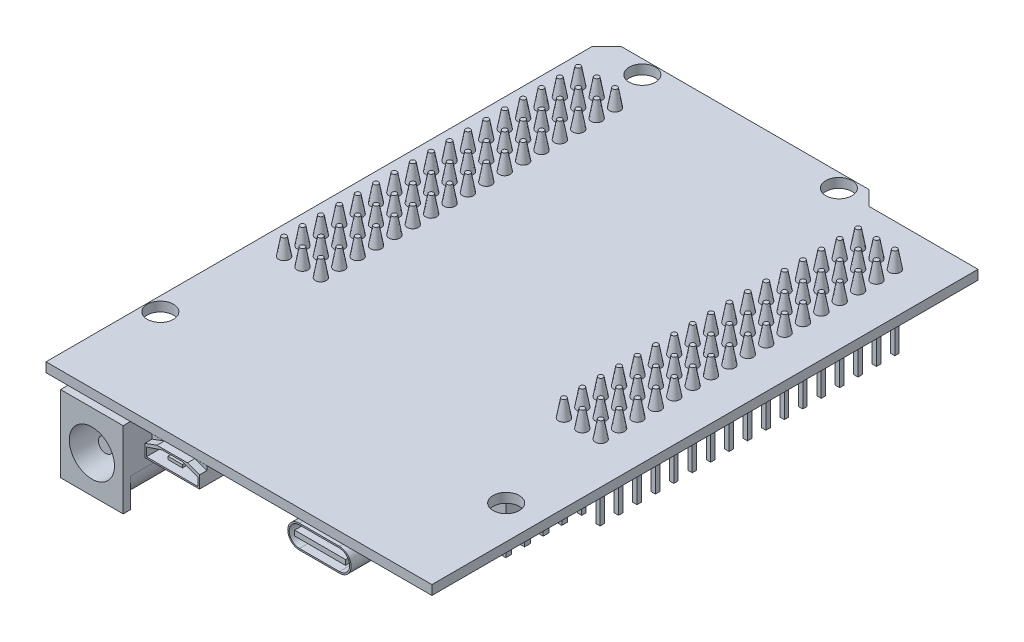
from build123d import *

# Parameters (mm, degrees)
SKETCH1_R                     = 1.8
BOSS_EXTRUDE1_DEPTH           = 1.3
SKETCH2_R                     = 0.75
BOSS_EXTRUDE2_DEPTH           = 2.4
BOSS_EXTRUDE2_TAPER           = 10
BOSS_EXTRUDE2_OTHER_WAY_DEPTH = 10
BOSS_EXTRUDE2_OTHER_WAY_TAPER = 3
SKETCH3_W                     = 2.525
SKETCH3_H                     = 42.925
BOSS_EXTRUDE3_DEPTH           = 2.525
SKETCH3_3_W                   = 2.525
SKETCH3_3_H                   = 42.925
BOSS_EXTRUDE4_DEPTH           = 2.525
SKETCH3_4_W                   = 2.525
SKETCH3_4_H                   = 42.925
BOSS_EXTRUDE5_DEPTH           = 2.525
SKETCH4_W                     = 8.6
SKETCH4_H                     = 10.5
SKETCH4_R                     = 3.1
BOSS_EXTRUDE6_DEPTH           = 10
FILLET1_R                     = 4
BOSS_EXTRUDE7_START           = 1
SKETCH4_2_W                   = 8.6
SKETCH4_2_H                   = 10.5
SKETCH4_2_R                   = 3.1
BOSS_EXTRUDE7_DEPTH           = 1
BOSS_EXTRUDE8_DEPTH           = 1
SKETCH7_W                     = 2.525
SKETCH7_H                     = 48.6
BOSS_EXTRUDE9_DEPTH           = 10.8
SKETCH8_W                     = 27.4
SKETCH8_H                     = 54.8
BOSS_EXTRUDE10_DEPTH          = 1.3
SKETCH9_W                     = 54.8
SKETCH9_H                     = 1.3
BOSS_EXTRUDE11_DEPTH          = 0.1
SKETCH10_W                    = 27.5
SKETCH10_H                    = 1.3
BOSS_EXTRUDE12_DEPTH          = 0.1
SKETCH11_W                    = 54.9
SKETCH11_H                    = 1.3
BOSS_EXTRUDE13_DEPTH          = 0.1
SKETCH12_W                    = 27.6
SKETCH12_H                    = 1.3
BOSS_EXTRUDE14_DEPTH          = 0.1
SKETCH13_R                    = 1
BOSS_EXTRUDE15_DEPTH          = 8.1
SKETCH14_R                    = 1.4
CUT_EXTRUDE1_DEPTH            = 1.3
SKETCH15_R                    = 0.9
BOSS_EXTRUDE16_DEPTH          = 1
BOSS_EXTRUDE16_TAPER          = 25
SKETCH16_W                    = 15.8
SKETCH16_H                    = 17.5
BOSS_EXTRUDE17_DEPTH          = 3
SKETCH17_W                    = 15.8
SKETCH17_H                    = 7.7
BOSS_EXTRUDE18_DEPTH          = 1
SKETCH18_W                    = 7.5
SKETCH18_H                    = 5.2
BOSS_EXTRUDE19_DEPTH          = 2.3
SKETCH19_W                    = 3.454198242
SKETCH19_H                    = 0.789142839
CUT_EXTRUDE2_DEPTH            = 1
CUT_EXTRUDE3_DEPTH            = 3.9
SKETCH21_W                    = 2
SKETCH21_H                    = 0.4
BOSS_EXTRUDE20_DEPTH          = 3.5
CUT_EXTRUDE4_DEPTH            = 1.3
SKETCH23_W                    = 2.7
SKETCH23_H                    = 3.7
BOSS_EXTRUDE21_DEPTH          = 1.1
SKETCH24_R                    = 0.75
BOSS_EXTRUDE22_DEPTH          = 0.5
BOSS_EXTRUDE23_DEPTH          = 0.5
BOSS_EXTRUDE23_DEPTH_BACK     = 6.6
BOSS_EXTRUDE24_DEPTH          = 0.5
SKETCH27_W                    = 7
SKETCH27_H                    = 0.7
BOSS_EXTRUDE25_DEPTH          = 6.5
LPATTERN1_COUNT               = 2
LPATTERN1_PITCH               = 27
SKETCH29_W                    = 5.12
SKETCH29_H                    = 10.24
BOSS_EXTRUDE26_DEPTH          = 2.6
SKETCH30_W                    = 0.6
SKETCH30_H                    = 0.6
BOSS_EXTRUDE27_DEPTH          = 5.5
SKETCH31_W                    = 0.6
SKETCH31_H                    = 0.6
BOSS_EXTRUDE28_DEPTH          = 7.5
SKETCH34_W                    = 13.1738133
SKETCH34_H                    = 54.591483904
SKETCH34_W_2                  = 0.6
SKETCH34_H_2                  = 0.6
SKETCH34_W_3                  = 10.47916967
SKETCH34_H_3                  = 53.892872592
CUT_EXTRUDE5_DEPTH            = 6.175
SKETCH36_W                    = 5.12
SKETCH36_H                    = 10.24
BOSS_EXTRUDE29_DEPTH          = 2.6
SKETCH37_W                    = 0.8
SKETCH37_H                    = 0.8
BOSS_EXTRUDE30_DEPTH          = 5.5


with BuildPart() as part:
    # Sketch1 → Boss-Extrude1 (new body)
    with BuildSketch(Plane(origin=(0, 0, 0), x_dir=(1, 0, 0), z_dir=(0, 1, 0))):
        Polygon((0, 0), (0, 75), (2, 77), (36, 77), (38, 75), (53, 75), (53, 0), align=None)
        with Locations(Location((6.8, 75.1, 0), (0, 0, 270))):
            Circle(SKETCH1_R, mode=Mode.SUBTRACT)
        with Locations(Location((33.8, 75.1, 0), (0, 0, 270))):
            Circle(SKETCH1_R, mode=Mode.SUBTRACT)
        with Locations(Location((1.9, 13.8, 0), (0, 0, 270))):
            Circle(SKETCH1_R, mode=Mode.SUBTRACT)
        with Locations(Location((48.4, 14.8, 0), (0, 0, 270))):
            Circle(SKETCH1_R, mode=Mode.SUBTRACT)
    extrude(amount=BOSS_EXTRUDE1_DEPTH)

    # Sketch2 → Boss-Extrude2 (add)
    with BuildSketch(Plane(origin=(0, 1.3, 0), x_dir=(1, 0, 0), z_dir=(0, 1, 0))):
        with Locations((3.8, 69.3)):
            Circle(SKETCH2_R)
        with Locations((6.325, 69.3)):
            Circle(SKETCH2_R)
        with Locations((8.85, 69.3)):
            Circle(SKETCH2_R)
        with Locations((6.325, 66.775)):
            Circle(SKETCH2_R)
        with Locations((8.85, 66.775)):
            Circle(SKETCH2_R)
        with Locations((6.325, 64.25)):
            Circle(SKETCH2_R)
        with Locations((8.85, 64.25)):
            Circle(SKETCH2_R)
        with Locations((6.325, 61.725)):
            Circle(SKETCH2_R)
        with Locations((8.85, 61.725)):
            Circle(SKETCH2_R)
        with Locations((6.325, 59.2)):
            Circle(SKETCH2_R)
        with Locations((8.85, 59.2)):
            Circle(SKETCH2_R)
        with Locations((6.325, 56.675)):
            Circle(SKETCH2_R)
        with Locations((8.85, 56.675)):
            Circle(SKETCH2_R)
        with Locations((6.325, 54.15)):
            Circle(SKETCH2_R)
        with Locations((8.85, 54.15)):
            Circle(SKETCH2_R)
        with Locations((6.325, 51.625)):
            Circle(SKETCH2_R)
        with Locations((8.85, 51.625)):
            Circle(SKETCH2_R)
        with Locations((6.325, 49.1)):
            Circle(SKETCH2_R)
        with Locations((8.85, 49.1)):
            Circle(SKETCH2_R)
        with Locations((6.325, 46.575)):
            Circle(SKETCH2_R)
        with Locations((8.85, 46.575)):
            Circle(SKETCH2_R)
        with Locations((6.325, 44.05)):
            Circle(SKETCH2_R)
        with Locations((8.85, 44.05)):
            Circle(SKETCH2_R)
        with Locations((6.325, 41.525)):
            Circle(SKETCH2_R)
        with Locations((8.85, 41.525)):
            Circle(SKETCH2_R)
        with Locations((6.325, 39)):
            Circle(SKETCH2_R)
        with Locations((8.85, 39)):
            Circle(SKETCH2_R)
        with Locations((6.325, 36.475)):
            Circle(SKETCH2_R)
        with Locations((8.85, 36.475)):
            Circle(SKETCH2_R)
        with Locations((6.325, 33.95)):
            Circle(SKETCH2_R)
        with Locations((8.85, 33.95)):
            Circle(SKETCH2_R)
        with Locations((6.325, 31.425)):
            Circle(SKETCH2_R)
        with Locations((8.85, 31.425)):
            Circle(SKETCH2_R)
        with Locations((3.8, 66.775)):
            Circle(SKETCH2_R)
        with Locations((3.8, 64.25)):
            Circle(SKETCH2_R)
        with Locations((3.8, 61.725)):
            Circle(SKETCH2_R)
        with Locations((3.8, 59.2)):
            Circle(SKETCH2_R)
        with Locations((3.8, 56.675)):
            Circle(SKETCH2_R)
        with Locations((3.8, 54.15)):
            Circle(SKETCH2_R)
        with Locations((3.8, 51.625)):
            Circle(SKETCH2_R)
        with Locations((3.8, 49.1)):
            Circle(SKETCH2_R)
        with Locations((3.8, 46.575)):
            Circle(SKETCH2_R)
        with Locations((3.8, 44.05)):
            Circle(SKETCH2_R)
        with Locations((3.8, 41.525)):
            Circle(SKETCH2_R)
        with Locations((3.8, 39)):
            Circle(SKETCH2_R)
        with Locations((3.8, 36.475)):
            Circle(SKETCH2_R)
        with Locations((3.8, 33.95)):
            Circle(SKETCH2_R)
        with Locations((3.8, 31.425)):
            Circle(SKETCH2_R)
        with Locations((3.8, 28.9)):
            Circle(SKETCH2_R)
        with Locations((6.325, 28.9)):
            Circle(SKETCH2_R)
        with Locations((8.85, 28.9)):
            Circle(SKETCH2_R)
        with Locations((42.234359974, 28.9)):
            Circle(SKETCH2_R)
        with Locations((44.759359974, 28.9)):
            Circle(SKETCH2_R)
        with Locations((47.284359974, 28.9)):
            Circle(SKETCH2_R)
        with Locations((47.284359974, 31.425)):
            Circle(SKETCH2_R)
        with Locations((47.284359974, 33.95)):
            Circle(SKETCH2_R)
        with Locations((47.284359974, 36.475)):
            Circle(SKETCH2_R)
        with Locations((47.284359974, 39)):
            Circle(SKETCH2_R)
        with Locations((47.284359974, 41.525)):
            Circle(SKETCH2_R)
        with Locations((47.284359974, 44.05)):
            Circle(SKETCH2_R)
        with Locations((47.284359974, 46.575)):
            Circle(SKETCH2_R)
        with Locations((47.284359974, 49.1)):
            Circle(SKETCH2_R)
        with Locations((47.284359974, 51.625)):
            Circle(SKETCH2_R)
        with Locations((47.284359974, 54.15)):
            Circle(SKETCH2_R)
        with Locations((47.284359974, 56.675)):
            Circle(SKETCH2_R)
        with Locations((47.284359974, 59.2)):
            Circle(SKETCH2_R)
        with Locations((47.284359974, 61.725)):
            Circle(SKETCH2_R)
        with Locations((47.284359974, 64.25)):
            Circle(SKETCH2_R)
        with Locations((47.284359974, 66.775)):
            Circle(SKETCH2_R)
        with Locations((42.234359974, 31.425)):
            Circle(SKETCH2_R)
        with Locations((44.759359974, 31.425)):
            Circle(SKETCH2_R)
        with Locations((42.234359974, 33.95)):
            Circle(SKETCH2_R)
        with Locations((44.759359974, 33.95)):
            Circle(SKETCH2_R)
        with Locations((42.234359974, 36.475)):
            Circle(SKETCH2_R)
        with Locations((44.759359974, 36.475)):
            Circle(SKETCH2_R)
        with Locations((42.234359974, 39)):
            Circle(SKETCH2_R)
        with Locations((44.759359974, 39)):
            Circle(SKETCH2_R)
        with Locations((42.234359974, 41.525)):
            Circle(SKETCH2_R)
        with Locations((44.759359974, 41.525)):
            Circle(SKETCH2_R)
        with Locations((42.234359974, 44.05)):
            Circle(SKETCH2_R)
        with Locations((44.759359974, 44.05)):
            Circle(SKETCH2_R)
        with Locations((42.234359974, 46.575)):
            Circle(SKETCH2_R)
        with Locations((44.759359974, 46.575)):
            Circle(SKETCH2_R)
        with Locations((42.234359974, 49.1)):
            Circle(SKETCH2_R)
        with Locations((44.759359974, 49.1)):
            Circle(SKETCH2_R)
        with Locations((42.234359974, 51.625)):
            Circle(SKETCH2_R)
        with Locations((44.759359974, 51.625)):
            Circle(SKETCH2_R)
        with Locations((42.234359974, 54.15)):
            Circle(SKETCH2_R)
        with Locations((44.759359974, 54.15)):
            Circle(SKETCH2_R)
        with Locations((42.234359974, 56.675)):
            Circle(SKETCH2_R)
        with Locations((44.759359974, 56.675)):
            Circle(SKETCH2_R)
        with Locations((42.234359974, 59.2)):
            Circle(SKETCH2_R)
        with Locations((44.759359974, 59.2)):
            Circle(SKETCH2_R)
        with Locations((42.234359974, 61.725)):
            Circle(SKETCH2_R)
        with Locations((44.759359974, 61.725)):
            Circle(SKETCH2_R)
        with Locations((42.234359974, 64.25)):
            Circle(SKETCH2_R)
        with Locations((44.759359974, 64.25)):
            Circle(SKETCH2_R)
        with Locations((42.234359974, 66.775)):
            Circle(SKETCH2_R)
        with Locations((44.759359974, 66.775)):
            Circle(SKETCH2_R)
        with Locations((42.234359974, 69.3)):
            Circle(SKETCH2_R)
        with Locations((44.759359974, 69.3)):
            Circle(SKETCH2_R)
        with Locations((47.284359974, 69.3)):
            Circle(SKETCH2_R)
    extrude(amount=BOSS_EXTRUDE2_DEPTH, taper=BOSS_EXTRUDE2_TAPER)

    # Sketch2 → Boss-Extrude2 other way (add)
    with BuildSketch(Plane(origin=(0, 1.3, 0), x_dir=(1, 0, 0), z_dir=(0, 1, 0))):
        with Locations((3.8, 69.3)):
            Circle(SKETCH2_R)
        with Locations((6.325, 69.3)):
            Circle(SKETCH2_R)
        with Locations((8.85, 69.3)):
            Circle(SKETCH2_R)
        with Locations((6.325, 66.775)):
            Circle(SKETCH2_R)
        with Locations((8.85, 66.775)):
            Circle(SKETCH2_R)
        with Locations((6.325, 64.25)):
            Circle(SKETCH2_R)
        with Locations((8.85, 64.25)):
            Circle(SKETCH2_R)
        with Locations((6.325, 61.725)):
            Circle(SKETCH2_R)
        with Locations((8.85, 61.725)):
            Circle(SKETCH2_R)
        with Locations((6.325, 59.2)):
            Circle(SKETCH2_R)
        with Locations((8.85, 59.2)):
            Circle(SKETCH2_R)
        with Locations((6.325, 56.675)):
            Circle(SKETCH2_R)
        with Locations((8.85, 56.675)):
            Circle(SKETCH2_R)
        with Locations((6.325, 54.15)):
            Circle(SKETCH2_R)
        with Locations((8.85, 54.15)):
            Circle(SKETCH2_R)
        with Locations((6.325, 51.625)):
            Circle(SKETCH2_R)
        with Locations((8.85, 51.625)):
            Circle(SKETCH2_R)
        with Locations((6.325, 49.1)):
            Circle(SKETCH2_R)
        with Locations((8.85, 49.1)):
            Circle(SKETCH2_R)
        with Locations((6.325, 46.575)):
            Circle(SKETCH2_R)
        with Locations((8.85, 46.575)):
            Circle(SKETCH2_R)
        with Locations((6.325, 44.05)):
            Circle(SKETCH2_R)
        with Locations((8.85, 44.05)):
            Circle(SKETCH2_R)
        with Locations((6.325, 41.525)):
            Circle(SKETCH2_R)
        with Locations((8.85, 41.525)):
            Circle(SKETCH2_R)
        with Locations((6.325, 39)):
            Circle(SKETCH2_R)
        with Locations((8.85, 39)):
            Circle(SKETCH2_R)
        with Locations((6.325, 36.475)):
            Circle(SKETCH2_R)
        with Locations((8.85, 36.475)):
            Circle(SKETCH2_R)
        with Locations((6.325, 33.95)):
            Circle(SKETCH2_R)
        with Locations((8.85, 33.95)):
            Circle(SKETCH2_R)
        with Locations((6.325, 31.425)):
            Circle(SKETCH2_R)
        with Locations((8.85, 31.425)):
            Circle(SKETCH2_R)
        with Locations((3.8, 66.775)):
            Circle(SKETCH2_R)
        with Locations((3.8, 64.25)):
            Circle(SKETCH2_R)
        with Locations((3.8, 61.725)):
            Circle(SKETCH2_R)
        with Locations((3.8, 59.2)):
            Circle(SKETCH2_R)
        with Locations((3.8, 56.675)):
            Circle(SKETCH2_R)
        with Locations((3.8, 54.15)):
            Circle(SKETCH2_R)
        with Locations((3.8, 51.625)):
            Circle(SKETCH2_R)
        with Locations((3.8, 49.1)):
            Circle(SKETCH2_R)
        with Locations((3.8, 46.575)):
            Circle(SKETCH2_R)
        with Locations((3.8, 44.05)):
            Circle(SKETCH2_R)
        with Locations((3.8, 41.525)):
            Circle(SKETCH2_R)
        with Locations((3.8, 39)):
            Circle(SKETCH2_R)
        with Locations((3.8, 36.475)):
            Circle(SKETCH2_R)
        with Locations((3.8, 33.95)):
            Circle(SKETCH2_R)
        with Locations((3.8, 31.425)):
            Circle(SKETCH2_R)
        with Locations((3.8, 28.9)):
            Circle(SKETCH2_R)
        with Locations((6.325, 28.9)):
            Circle(SKETCH2_R)
        with Locations((8.85, 28.9)):
            Circle(SKETCH2_R)
        with Locations((42.234359974, 28.9)):
            Circle(SKETCH2_R)
        with Locations((44.759359974, 28.9)):
            Circle(SKETCH2_R)
        with Locations((47.284359974, 28.9)):
            Circle(SKETCH2_R)
        with Locations((47.284359974, 31.425)):
            Circle(SKETCH2_R)
        with Locations((47.284359974, 33.95)):
            Circle(SKETCH2_R)
        with Locations((47.284359974, 36.475)):
            Circle(SKETCH2_R)
        with Locations((47.284359974, 39)):
            Circle(SKETCH2_R)
        with Locations((47.284359974, 41.525)):
            Circle(SKETCH2_R)
        with Locations((47.284359974, 44.05)):
            Circle(SKETCH2_R)
        with Locations((47.284359974, 46.575)):
            Circle(SKETCH2_R)
        with Locations((47.284359974, 49.1)):
            Circle(SKETCH2_R)
        with Locations((47.284359974, 51.625)):
            Circle(SKETCH2_R)
        with Locations((47.284359974, 54.15)):
            Circle(SKETCH2_R)
        with Locations((47.284359974, 56.675)):
            Circle(SKETCH2_R)
        with Locations((47.284359974, 59.2)):
            Circle(SKETCH2_R)
        with Locations((47.284359974, 61.725)):
            Circle(SKETCH2_R)
        with Locations((47.284359974, 64.25)):
            Circle(SKETCH2_R)
        with Locations((47.284359974, 66.775)):
            Circle(SKETCH2_R)
        with Locations((42.234359974, 31.425)):
            Circle(SKETCH2_R)
        with Locations((44.759359974, 31.425)):
            Circle(SKETCH2_R)
        with Locations((42.234359974, 33.95)):
            Circle(SKETCH2_R)
        with Locations((44.759359974, 33.95)):
            Circle(SKETCH2_R)
        with Locations((42.234359974, 36.475)):
            Circle(SKETCH2_R)
        with Locations((44.759359974, 36.475)):
            Circle(SKETCH2_R)
        with Locations((42.234359974, 39)):
            Circle(SKETCH2_R)
        with Locations((44.759359974, 39)):
            Circle(SKETCH2_R)
        with Locations((42.234359974, 41.525)):
            Circle(SKETCH2_R)
        with Locations((44.759359974, 41.525)):
            Circle(SKETCH2_R)
        with Locations((42.234359974, 44.05)):
            Circle(SKETCH2_R)
        with Locations((44.759359974, 44.05)):
            Circle(SKETCH2_R)
        with Locations((42.234359974, 46.575)):
            Circle(SKETCH2_R)
        with Locations((44.759359974, 46.575)):
            Circle(SKETCH2_R)
        with Locations((42.234359974, 49.1)):
            Circle(SKETCH2_R)
        with Locations((44.759359974, 49.1)):
            Circle(SKETCH2_R)
        with Locations((42.234359974, 51.625)):
            Circle(SKETCH2_R)
        with Locations((44.759359974, 51.625)):
            Circle(SKETCH2_R)
        with Locations((42.234359974, 54.15)):
            Circle(SKETCH2_R)
        with Locations((44.759359974, 54.15)):
            Circle(SKETCH2_R)
        with Locations((42.234359974, 56.675)):
            Circle(SKETCH2_R)
        with Locations((44.759359974, 56.675)):
            Circle(SKETCH2_R)
        with Locations((42.234359974, 59.2)):
            Circle(SKETCH2_R)
        with Locations((44.759359974, 59.2)):
            Circle(SKETCH2_R)
        with Locations((42.234359974, 61.725)):
            Circle(SKETCH2_R)
        with Locations((44.759359974, 61.725)):
            Circle(SKETCH2_R)
        with Locations((42.234359974, 64.25)):
            Circle(SKETCH2_R)
        with Locations((44.759359974, 64.25)):
            Circle(SKETCH2_R)
        with Locations((42.234359974, 66.775)):
            Circle(SKETCH2_R)
        with Locations((44.759359974, 66.775)):
            Circle(SKETCH2_R)
        with Locations((42.234359974, 69.3)):
            Circle(SKETCH2_R)
        with Locations((44.759359974, 69.3)):
            Circle(SKETCH2_R)
        with Locations((47.284359974, 69.3)):
            Circle(SKETCH2_R)
    extrude(amount=-BOSS_EXTRUDE2_OTHER_WAY_DEPTH, taper=BOSS_EXTRUDE2_OTHER_WAY_TAPER)

    # Sketch3 → Boss-Extrude3 (add)
    with BuildSketch(Plane.XZ):
        with Locations((3.8, -49.1)):
            Rectangle(SKETCH3_W, SKETCH3_H)
        with Locations((47.284359974, -49.1)):
            Rectangle(SKETCH3_W, SKETCH3_H)
    extrude(amount=BOSS_EXTRUDE3_DEPTH)

    # Sketch3<3> → Boss-Extrude4 (add)
    with BuildSketch(Plane.XZ):
        with Locations((6.34, -49.1)):
            Rectangle(SKETCH3_3_W, SKETCH3_3_H)
        with Locations((44.744359974, -49.1)):
            Rectangle(SKETCH3_3_W, SKETCH3_3_H)
    extrude(amount=BOSS_EXTRUDE4_DEPTH)

    # Sketch3<4> → Boss-Extrude5 (add)
    with BuildSketch(Plane.XZ):
        with Locations((8.88, -49.1)):
            Rectangle(SKETCH3_4_W, SKETCH3_4_H)
        with Locations((42.204359974, -49.1)):
            Rectangle(SKETCH3_4_W, SKETCH3_4_H)
    extrude(amount=BOSS_EXTRUDE5_DEPTH)

    # Sketch4 → Boss-Extrude6 (add)
    with BuildSketch(Plane.XY):
        with Locations((7.3, -5.25)):
            Rectangle(SKETCH4_W, SKETCH4_H)
        with Locations((7.3, -5.4)):
            Circle(SKETCH4_R, mode=Mode.SUBTRACT)
    extrude(amount=-BOSS_EXTRUDE6_DEPTH)

    # Fillet1
    fillet1_edges = [part.edges().sort_by_distance(p)[0] for p in [
        (11.6, -10.5, -5),
        (3, -10.5, -5),
    ]]
    fillet(fillet1_edges, radius=FILLET1_R)

    # Sketch4<2> → Boss-Extrude7 (add)
    with BuildSketch(Plane.XY.offset(BOSS_EXTRUDE7_START)):
        with Locations((7.3, -5.25)):
            Rectangle(SKETCH4_2_W, SKETCH4_2_H)
        with Locations((7.3, -5.4)):
            Circle(SKETCH4_2_R, mode=Mode.SUBTRACT)
    extrude(amount=-BOSS_EXTRUDE7_DEPTH)

    # Sketch5 → Boss-Extrude8 (add)
    with BuildSketch(Plane(origin=(0, 0, -10), x_dir=(-1, 0, 0), z_dir=(0, 0, -1))):
        with BuildLine():
            Line((-11.6, 0), (-11.6, -6.5))
            ThreePointArc((-11.6, -6.5), (-10.428427125, -9.328427125), (-7.6, -10.5))
            Line((-7.6, -10.5), (-7, -10.5))
            ThreePointArc((-7, -10.5), (-4.171572875, -9.328427125), (-3, -6.5))
            Line((-3, -6.5), (-3, 0))
            Line((-3, 0), (-11.6, 0))
        make_face()
    extrude(amount=-BOSS_EXTRUDE8_DEPTH)

    # Sketch7 → Boss-Extrude9 (add)
    with BuildSketch(Plane.XZ):
        with Locations((12.8625, -49.5)):
            Rectangle(SKETCH7_W, SKETCH7_H)
        with Locations((15.4225, -49.5)):
            Rectangle(SKETCH7_W, SKETCH7_H)
        with Locations((37.7375, -49.5)):
            Rectangle(SKETCH7_W, SKETCH7_H)
    extrude(amount=BOSS_EXTRUDE9_DEPTH)

    # Sketch8 → Boss-Extrude10 (add)
    with BuildSketch(Plane.XZ.offset(10.8)):
        with Locations((25.3, -49.6)):
            Rectangle(SKETCH8_W, SKETCH8_H)
    extrude(amount=BOSS_EXTRUDE10_DEPTH)

    # Sketch9 → Boss-Extrude11 (add)
    with BuildSketch(Plane(origin=(39, 0, 0), x_dir=(0, 0, -1), z_dir=(1, 0, 0))):
        with Locations((49.6, -11.45)):
            Rectangle(SKETCH9_W, SKETCH9_H)
    extrude(amount=BOSS_EXTRUDE11_DEPTH)

    # Sketch10 → Boss-Extrude12 (add)
    with BuildSketch(Plane.XY.offset(-22.2)):
        with Locations((25.35, -11.45)):
            Rectangle(SKETCH10_W, SKETCH10_H)
    extrude(amount=BOSS_EXTRUDE12_DEPTH)

    # Sketch11 → Boss-Extrude13 (add)
    with BuildSketch(Plane.ZY.offset(-11.6)):
        with Locations((-49.55, -11.45)):
            Rectangle(SKETCH11_W, SKETCH11_H)
    extrude(amount=BOSS_EXTRUDE13_DEPTH)

    # Sketch12 → Boss-Extrude14 (add)
    with BuildSketch(Plane(origin=(0, 0, -77), x_dir=(-1, 0, 0), z_dir=(0, 0, -1))):
        with Locations((-25.3, -11.45)):
            Rectangle(SKETCH12_W, SKETCH12_H)
    extrude(amount=BOSS_EXTRUDE14_DEPTH)

    # Sketch13 → Boss-Extrude15 (add)
    with BuildSketch(Plane.XY.offset(-9)):
        with Locations(Location((7.3, -5.4, 0), (0, 0, 180))):
            Circle(SKETCH13_R)
    extrude(amount=BOSS_EXTRUDE15_DEPTH)

    # Sketch14 → Cut-Extrude1 (cut)
    with BuildSketch(Plane.XZ.offset(12.1)):
        with Locations(Location((13.3, -23.9, 0), (0, 0, 270))):
            Circle(SKETCH14_R)
        with Locations(Location((13.3, -75.3, 0), (0, 0, 270))):
            Circle(SKETCH14_R)
        with Locations(Location((37.3, -23.9, 0), (0, 0, 248.213210702))):
            Circle(SKETCH14_R)
        with Locations(Location((37.3, -75.3, 0), (0, 0, 270))):
            Circle(SKETCH14_R)
    extrude(amount=-CUT_EXTRUDE1_DEPTH, mode=Mode.SUBTRACT)

    # Sketch15 → Boss-Extrude16 (add)
    with BuildSketch(Plane.XZ.offset(12.1)):
        with Locations((14.025, -71.275)):
            Circle(SKETCH15_R)
        with Locations((14.025, -68.745)):
            Circle(SKETCH15_R)
        with Locations((14.025, -66.215)):
            Circle(SKETCH15_R)
        with Locations((14.025, -63.685)):
            Circle(SKETCH15_R)
        with Locations((14.025, -61.155)):
            Circle(SKETCH15_R)
        with Locations((14.025, -58.625)):
            Circle(SKETCH15_R)
        with Locations((14.025, -56.095)):
            Circle(SKETCH15_R)
        with Locations((14.025, -53.565)):
            Circle(SKETCH15_R)
        with Locations((14.025, -51.035)):
            Circle(SKETCH15_R)
        with Locations((14.025, -48.505)):
            Circle(SKETCH15_R)
        with Locations((14.025, -45.975)):
            Circle(SKETCH15_R)
        with Locations((14.025, -43.445)):
            Circle(SKETCH15_R)
        with Locations((14.025, -40.915)):
            Circle(SKETCH15_R)
        with Locations((14.025, -38.385)):
            Circle(SKETCH15_R)
        with Locations((14.025, -35.855)):
            Circle(SKETCH15_R)
        with Locations((14.025, -33.325)):
            Circle(SKETCH15_R)
        with Locations((14.025, -30.795)):
            Circle(SKETCH15_R)
        with Locations((14.025, -28.265)):
            Circle(SKETCH15_R)
        with Locations((36.575, -28.265)):
            Circle(SKETCH15_R)
        with Locations((36.575, -30.795)):
            Circle(SKETCH15_R)
        with Locations((36.575, -33.325)):
            Circle(SKETCH15_R)
        with Locations((36.575, -35.855)):
            Circle(SKETCH15_R)
        with Locations((36.575, -38.385)):
            Circle(SKETCH15_R)
        with Locations((36.575, -40.915)):
            Circle(SKETCH15_R)
        with Locations((36.575, -43.445)):
            Circle(SKETCH15_R)
        with Locations((36.575, -45.975)):
            Circle(SKETCH15_R)
        with Locations((36.575, -48.505)):
            Circle(SKETCH15_R)
        with Locations((36.575, -51.035)):
            Circle(SKETCH15_R)
        with Locations((36.575, -53.565)):
            Circle(SKETCH15_R)
        with Locations((36.575, -56.095)):
            Circle(SKETCH15_R)
        with Locations((36.575, -58.625)):
            Circle(SKETCH15_R)
        with Locations((36.575, -61.155)):
            Circle(SKETCH15_R)
        with Locations((36.575, -63.685)):
            Circle(SKETCH15_R)
        with Locations((36.575, -66.215)):
            Circle(SKETCH15_R)
        with Locations((36.575, -68.745)):
            Circle(SKETCH15_R)
        with Locations((36.575, -71.275)):
            Circle(SKETCH15_R)
    extrude(amount=BOSS_EXTRUDE16_DEPTH, taper=BOSS_EXTRUDE16_TAPER)

    # Sketch16 → Boss-Extrude17 (add)
    with BuildSketch(Plane.XZ.offset(12.1)):
        with Locations((25.3, -60.65)):
            Rectangle(SKETCH16_W, SKETCH16_H)
    extrude(amount=BOSS_EXTRUDE17_DEPTH)

    # Sketch17 → Boss-Extrude18 (add)
    with BuildSketch(Plane.XZ.offset(12.1)):
        with Locations((25.3, -73.25)):
            Rectangle(SKETCH17_W, SKETCH17_H)
    extrude(amount=BOSS_EXTRUDE18_DEPTH)

    # Sketch18 → Boss-Extrude19 (add)
    with BuildSketch(Plane.XZ.offset(12.1)):
        with Locations((25.3, -24.7)):
            Rectangle(SKETCH18_W, SKETCH18_H)
    boss_extrude19 = extrude(amount=BOSS_EXTRUDE19_DEPTH)

    # Sketch19 → Cut-Extrude2 (cut)
    # profile 1 of 3: a face of its own
    with BuildSketch(Plane.XY.offset(-22.1)):
        Polygon((26.675700123, -12.3), (23.946955958, -12.3), (21.75, -13.03042035), (21.75, -14.2), (28.85, -14.2), (28.85, -13.0996639), align=None)
        with Locations((25.3, -13.223743794)):
            Rectangle(SKETCH19_W, SKETCH19_H, mode=Mode.SUBTRACT)
    # profile 2 of 3: a face of its own
    with BuildSketch(Plane.XY.offset(-22.1)):
        Polygon((27.390959614, -12.1), (29.05, -12.7), (29.05, -12.1), align=None)
    # profile 3 of 3: a face of its own
    with BuildSketch(Plane.XY.offset(-22.1)):
        Polygon((23.209040386, -12.1), (21.55, -12.1), (21.55, -12.7), align=None)
    cut_extrude2 = extrude(amount=-CUT_EXTRUDE2_DEPTH, mode=Mode.SUBTRACT)

    # Sketch20 → Cut-Extrude3 (cut)
    with BuildSketch(Plane.XY.offset(-22.1)):
        Polygon((26.675700123, -12.3), (23.946955958, -12.3), (21.75, -13.03042035), (21.75, -14.2), (28.85, -14.2), (28.85, -13.0996639), align=None)
    cut_extrude3 = extrude(amount=-CUT_EXTRUDE3_DEPTH, mode=Mode.SUBTRACT)

    # Sketch21 → Boss-Extrude20 (add)
    with BuildSketch(Plane.XY.offset(-26)):
        with Locations((25.30566402, -13.25)):
            Rectangle(SKETCH21_W, SKETCH21_H)
    boss_extrude20 = extrude(amount=BOSS_EXTRUDE20_DEPTH)

    # Sketch22 → Cut-Extrude4 (cut)
    with BuildSketch(Plane(origin=(0, -10.8, 0), x_dir=(1, 0, 0), z_dir=(0, 1, 0))):
        Polygon((20.472121, 22.1), (25.3, 22.1), (25.3, 23.177879), (21.55, 23.177879), align=None)
        Polygon((25.3, 23.177879), (25.3, 22.1), (30.127879, 22.1), (29.05, 23.177879), align=None)
    extrude(amount=-CUT_EXTRUDE4_DEPTH, mode=Mode.SUBTRACT)

    # Sketch23 → Boss-Extrude21 (add)
    with BuildSketch(Plane.XZ.offset(12.1)):
        with Locations((17.75, -24.75)):
            Rectangle(SKETCH23_W, SKETCH23_H)
        with Locations((32.85, -24.75)):
            Rectangle(SKETCH23_W, SKETCH23_H)
    extrude(amount=BOSS_EXTRUDE21_DEPTH)

    # Sketch24 → Boss-Extrude22 (add)
    with BuildSketch(Plane.XZ.offset(13.2)):
        with Locations(Location((17.75, -24.75, 0), (0, 0, 270))):
            Circle(SKETCH24_R)
        with Locations(Location((32.85, -24.75, 0), (0, 0, 90))):
            Circle(SKETCH24_R)
    extrude(amount=BOSS_EXTRUDE22_DEPTH)

    # Sketch25 → Boss-Extrude23 (add, two sides: drawn at the far end of the back side and taken through both)
    with BuildSketch(Plane.XY.offset(-BOSS_EXTRUDE23_DEPTH_BACK)):
        with BuildLine():
            Line((35.3, 0), (40.8, 0))
            ThreePointArc((40.8, 0), (42.4, -1.6), (40.8, -3.2))
            Line((40.8, -3.2), (35.3, -3.2))
            ThreePointArc((35.3, -3.2), (33.7, -1.6), (35.3, 0))
        make_face()
        with BuildLine():
            Line((35.3, -0.2), (40.8, -0.2))
            ThreePointArc((40.8, -0.2), (42.2, -1.6), (40.8, -3))
            Line((40.8, -3), (35.3, -3))
            ThreePointArc((35.3, -3), (33.9, -1.6), (35.3, -0.2))
        make_face(mode=Mode.SUBTRACT)
    extrude(amount=BOSS_EXTRUDE23_DEPTH + BOSS_EXTRUDE23_DEPTH_BACK)

    # Sketch26 → Boss-Extrude24 (add)
    with BuildSketch(Plane(origin=(0, 0, -6.6), x_dir=(-1, 0, 0), z_dir=(0, 0, -1))):
        with BuildLine():
            Line((-35.3, 0), (-40.8, 0))
            ThreePointArc((-40.8, 0), (-42.4, -1.6), (-40.8, -3.2))
            Line((-40.8, -3.2), (-35.3, -3.2))
            ThreePointArc((-35.3, -3.2), (-33.7, -1.6), (-35.3, 0))
        make_face()
    extrude(amount=-BOSS_EXTRUDE24_DEPTH)

    # Sketch27 → Boss-Extrude25 (add)
    with BuildSketch(Plane.XY.offset(-6.1)):
        with Locations((38.05, -1.6)):
            Rectangle(SKETCH27_W, SKETCH27_H)
    extrude(amount=BOSS_EXTRUDE25_DEPTH)

    # LPattern1: Boss-Extrude19, Cut-Extrude2, Cut-Extrude3, Boss-Extrude20 ×2
    with Locations(*[Vector(-0.2575271023099348, 0.44835653783456575, 0.8559533904114465) * (i * LPATTERN1_PITCH) for i in range(1, LPATTERN1_COUNT)]):
        add(boss_extrude19)
        add(cut_extrude2, mode=Mode.SUBTRACT)
        add(cut_extrude3, mode=Mode.SUBTRACT)
        add(boss_extrude20)

    # Sketch29 → Boss-Extrude26 (add)
    with BuildSketch(Plane.XZ):
        with Locations((5.96, -20.0175)):
            Rectangle(SKETCH29_W, SKETCH29_H)
    extrude(amount=BOSS_EXTRUDE26_DEPTH)

    # Sketch30 → Boss-Extrude27 (add)
    with BuildSketch(Plane.XZ.offset(2.6)):
        with Locations((7.23, -16.1675)):
            Rectangle(SKETCH30_W, SKETCH30_H)
        with Locations((4.67, -16.1675)):
            Rectangle(SKETCH30_W, SKETCH30_H)
        with Locations((7.23, -18.7275)):
            Rectangle(SKETCH30_W, SKETCH30_H)
        with Locations((7.23, -21.2875)):
            Rectangle(SKETCH30_W, SKETCH30_H)
        with Locations((7.23, -23.8475)):
            Rectangle(SKETCH30_W, SKETCH30_H)
        with Locations((4.67, -18.7275)):
            Rectangle(SKETCH30_W, SKETCH30_H)
        with Locations((4.67, -21.2875)):
            Rectangle(SKETCH30_W, SKETCH30_H)
        with Locations((4.67, -23.8475)):
            Rectangle(SKETCH30_W, SKETCH30_H)
    extrude(amount=BOSS_EXTRUDE27_DEPTH)

    # Sketch31 → Boss-Extrude28 (add)
    with BuildSketch(Plane.XZ.offset(8.7)):
        with Locations((44.754359974, -69.3)):
            Rectangle(SKETCH31_W, SKETCH31_H)
        with Locations((47.284359974, -69.3)):
            Rectangle(SKETCH31_W, SKETCH31_H)
        with Locations((42.224359974, -69.3)):
            Rectangle(SKETCH31_W, SKETCH31_H)
        with Locations((44.754359974, -66.77)):
            Rectangle(SKETCH31_W, SKETCH31_H)
        with Locations((42.224359974, -66.77)):
            Rectangle(SKETCH31_W, SKETCH31_H)
        with Locations((44.754359974, -64.24)):
            Rectangle(SKETCH31_W, SKETCH31_H)
        with Locations((42.224359974, -64.24)):
            Rectangle(SKETCH31_W, SKETCH31_H)
        with Locations((44.754359974, -61.71)):
            Rectangle(SKETCH31_W, SKETCH31_H)
        with Locations((42.224359974, -61.71)):
            Rectangle(SKETCH31_W, SKETCH31_H)
        with Locations((44.754359974, -59.18)):
            Rectangle(SKETCH31_W, SKETCH31_H)
        with Locations((42.224359974, -59.18)):
            Rectangle(SKETCH31_W, SKETCH31_H)
        with Locations((44.754359974, -56.65)):
            Rectangle(SKETCH31_W, SKETCH31_H)
        with Locations((42.224359974, -56.65)):
            Rectangle(SKETCH31_W, SKETCH31_H)
        with Locations((44.754359974, -54.12)):
            Rectangle(SKETCH31_W, SKETCH31_H)
        with Locations((42.224359974, -54.12)):
            Rectangle(SKETCH31_W, SKETCH31_H)
        with Locations((44.754359974, -51.59)):
            Rectangle(SKETCH31_W, SKETCH31_H)
        with Locations((42.224359974, -51.59)):
            Rectangle(SKETCH31_W, SKETCH31_H)
        with Locations((44.754359974, -49.06)):
            Rectangle(SKETCH31_W, SKETCH31_H)
        with Locations((42.224359974, -49.06)):
            Rectangle(SKETCH31_W, SKETCH31_H)
        with Locations((44.754359974, -46.53)):
            Rectangle(SKETCH31_W, SKETCH31_H)
        with Locations((42.224359974, -46.53)):
            Rectangle(SKETCH31_W, SKETCH31_H)
        with Locations((44.754359974, -44)):
            Rectangle(SKETCH31_W, SKETCH31_H)
        with Locations((42.224359974, -44)):
            Rectangle(SKETCH31_W, SKETCH31_H)
        with Locations((44.754359974, -41.47)):
            Rectangle(SKETCH31_W, SKETCH31_H)
        with Locations((42.224359974, -41.47)):
            Rectangle(SKETCH31_W, SKETCH31_H)
        with Locations((44.754359974, -38.94)):
            Rectangle(SKETCH31_W, SKETCH31_H)
        with Locations((42.224359974, -38.94)):
            Rectangle(SKETCH31_W, SKETCH31_H)
        with Locations((44.754359974, -36.41)):
            Rectangle(SKETCH31_W, SKETCH31_H)
        with Locations((42.224359974, -36.41)):
            Rectangle(SKETCH31_W, SKETCH31_H)
        with Locations((44.754359974, -33.88)):
            Rectangle(SKETCH31_W, SKETCH31_H)
        with Locations((42.224359974, -33.88)):
            Rectangle(SKETCH31_W, SKETCH31_H)
        with Locations((44.754359974, -31.35)):
            Rectangle(SKETCH31_W, SKETCH31_H)
        with Locations((42.224359974, -31.35)):
            Rectangle(SKETCH31_W, SKETCH31_H)
        with Locations((44.754359974, -28.82)):
            Rectangle(SKETCH31_W, SKETCH31_H)
        with Locations((42.224359974, -28.82)):
            Rectangle(SKETCH31_W, SKETCH31_H)
        with Locations((47.284359974, -66.77)):
            Rectangle(SKETCH31_W, SKETCH31_H)
        with Locations((47.284359974, -64.24)):
            Rectangle(SKETCH31_W, SKETCH31_H)
        with Locations((47.284359974, -61.71)):
            Rectangle(SKETCH31_W, SKETCH31_H)
        with Locations((47.284359974, -59.18)):
            Rectangle(SKETCH31_W, SKETCH31_H)
        with Locations((47.284359974, -56.65)):
            Rectangle(SKETCH31_W, SKETCH31_H)
        with Locations((47.284359974, -54.12)):
            Rectangle(SKETCH31_W, SKETCH31_H)
        with Locations((47.284359974, -51.59)):
            Rectangle(SKETCH31_W, SKETCH31_H)
        with Locations((47.284359974, -49.06)):
            Rectangle(SKETCH31_W, SKETCH31_H)
        with Locations((47.284359974, -46.53)):
            Rectangle(SKETCH31_W, SKETCH31_H)
        with Locations((47.284359974, -44)):
            Rectangle(SKETCH31_W, SKETCH31_H)
        with Locations((47.284359974, -41.47)):
            Rectangle(SKETCH31_W, SKETCH31_H)
        with Locations((47.284359974, -38.94)):
            Rectangle(SKETCH31_W, SKETCH31_H)
        with Locations((47.284359974, -36.41)):
            Rectangle(SKETCH31_W, SKETCH31_H)
        with Locations((47.284359974, -33.88)):
            Rectangle(SKETCH31_W, SKETCH31_H)
        with Locations((47.284359974, -31.35)):
            Rectangle(SKETCH31_W, SKETCH31_H)
        with Locations((47.284359974, -28.82)):
            Rectangle(SKETCH31_W, SKETCH31_H)
        with Locations((3.8, -28.82)):
            Rectangle(SKETCH31_W, SKETCH31_H)
        with Locations((3.8, -31.35)):
            Rectangle(SKETCH31_W, SKETCH31_H)
        with Locations((3.8, -33.88)):
            Rectangle(SKETCH31_W, SKETCH31_H)
        with Locations((3.8, -36.41)):
            Rectangle(SKETCH31_W, SKETCH31_H)
        with Locations((3.8, -38.94)):
            Rectangle(SKETCH31_W, SKETCH31_H)
        with Locations((3.8, -41.47)):
            Rectangle(SKETCH31_W, SKETCH31_H)
        with Locations((3.8, -44)):
            Rectangle(SKETCH31_W, SKETCH31_H)
        with Locations((3.8, -46.53)):
            Rectangle(SKETCH31_W, SKETCH31_H)
        with Locations((3.8, -49.06)):
            Rectangle(SKETCH31_W, SKETCH31_H)
        with Locations((3.8, -51.59)):
            Rectangle(SKETCH31_W, SKETCH31_H)
        with Locations((3.8, -54.12)):
            Rectangle(SKETCH31_W, SKETCH31_H)
        with Locations((3.8, -56.65)):
            Rectangle(SKETCH31_W, SKETCH31_H)
        with Locations((3.8, -59.18)):
            Rectangle(SKETCH31_W, SKETCH31_H)
        with Locations((3.8, -61.71)):
            Rectangle(SKETCH31_W, SKETCH31_H)
        with Locations((3.8, -64.24)):
            Rectangle(SKETCH31_W, SKETCH31_H)
        with Locations((3.8, -66.77)):
            Rectangle(SKETCH31_W, SKETCH31_H)
        with Locations((8.86, -28.82)):
            Rectangle(SKETCH31_W, SKETCH31_H)
        with Locations((6.33, -28.82)):
            Rectangle(SKETCH31_W, SKETCH31_H)
        with Locations((8.86, -31.35)):
            Rectangle(SKETCH31_W, SKETCH31_H)
        with Locations((6.33, -31.35)):
            Rectangle(SKETCH31_W, SKETCH31_H)
        with Locations((8.86, -33.88)):
            Rectangle(SKETCH31_W, SKETCH31_H)
        with Locations((6.33, -33.88)):
            Rectangle(SKETCH31_W, SKETCH31_H)
        with Locations((8.86, -36.41)):
            Rectangle(SKETCH31_W, SKETCH31_H)
        with Locations((6.33, -36.41)):
            Rectangle(SKETCH31_W, SKETCH31_H)
        with Locations((8.86, -38.94)):
            Rectangle(SKETCH31_W, SKETCH31_H)
        with Locations((6.33, -38.94)):
            Rectangle(SKETCH31_W, SKETCH31_H)
        with Locations((8.86, -41.47)):
            Rectangle(SKETCH31_W, SKETCH31_H)
        with Locations((6.33, -41.47)):
            Rectangle(SKETCH31_W, SKETCH31_H)
        with Locations((8.86, -44)):
            Rectangle(SKETCH31_W, SKETCH31_H)
        with Locations((6.33, -44)):
            Rectangle(SKETCH31_W, SKETCH31_H)
        with Locations((8.86, -46.53)):
            Rectangle(SKETCH31_W, SKETCH31_H)
        with Locations((6.33, -46.53)):
            Rectangle(SKETCH31_W, SKETCH31_H)
        with Locations((8.86, -49.06)):
            Rectangle(SKETCH31_W, SKETCH31_H)
        with Locations((6.33, -49.06)):
            Rectangle(SKETCH31_W, SKETCH31_H)
        with Locations((8.86, -51.59)):
            Rectangle(SKETCH31_W, SKETCH31_H)
        with Locations((6.33, -51.59)):
            Rectangle(SKETCH31_W, SKETCH31_H)
        with Locations((8.86, -54.12)):
            Rectangle(SKETCH31_W, SKETCH31_H)
        with Locations((6.33, -54.12)):
            Rectangle(SKETCH31_W, SKETCH31_H)
        with Locations((8.86, -56.65)):
            Rectangle(SKETCH31_W, SKETCH31_H)
        with Locations((6.33, -56.65)):
            Rectangle(SKETCH31_W, SKETCH31_H)
        with Locations((8.86, -59.18)):
            Rectangle(SKETCH31_W, SKETCH31_H)
        with Locations((6.33, -59.18)):
            Rectangle(SKETCH31_W, SKETCH31_H)
        with Locations((8.86, -61.71)):
            Rectangle(SKETCH31_W, SKETCH31_H)
        with Locations((6.33, -61.71)):
            Rectangle(SKETCH31_W, SKETCH31_H)
        with Locations((8.86, -64.24)):
            Rectangle(SKETCH31_W, SKETCH31_H)
        with Locations((6.33, -64.24)):
            Rectangle(SKETCH31_W, SKETCH31_H)
        with Locations((8.86, -66.77)):
            Rectangle(SKETCH31_W, SKETCH31_H)
        with Locations((6.33, -66.77)):
            Rectangle(SKETCH31_W, SKETCH31_H)
        with Locations((8.86, -69.3)):
            Rectangle(SKETCH31_W, SKETCH31_H)
        with Locations((6.33, -69.3)):
            Rectangle(SKETCH31_W, SKETCH31_H)
        with Locations((3.8, -69.3)):
            Rectangle(SKETCH31_W, SKETCH31_H)
    extrude(amount=-BOSS_EXTRUDE28_DEPTH)

    # Sketch34 → Cut-Extrude5 (cut)
    # profile 1 of 2: a face of its own
    with BuildSketch(Plane.XZ.offset(8.7)):
        with Locations((4.144438036, -54.121706149)):
            Rectangle(SKETCH34_W, SKETCH34_H)
        with Locations((3.8, -66.77)):
            Rectangle(SKETCH34_W_2, SKETCH34_H_2, mode=Mode.SUBTRACT)
        with Locations((3.8, -64.24)):
            Rectangle(SKETCH34_W_2, SKETCH34_H_2, mode=Mode.SUBTRACT)
        with Locations((3.8, -61.71)):
            Rectangle(SKETCH34_W_2, SKETCH34_H_2, mode=Mode.SUBTRACT)
        with Locations((6.33, -31.35)):
            Rectangle(SKETCH34_W_2, SKETCH34_H_2, mode=Mode.SUBTRACT)
        with Locations((8.86, -31.35)):
            Rectangle(SKETCH34_W_2, SKETCH34_H_2, mode=Mode.SUBTRACT)
        with Locations((6.33, -28.82)):
            Rectangle(SKETCH34_W_2, SKETCH34_H_2, mode=Mode.SUBTRACT)
        with Locations((8.86, -28.82)):
            Rectangle(SKETCH34_W_2, SKETCH34_H_2, mode=Mode.SUBTRACT)
        with Locations((6.33, -36.41)):
            Rectangle(SKETCH34_W_2, SKETCH34_H_2, mode=Mode.SUBTRACT)
        with Locations((8.86, -36.41)):
            Rectangle(SKETCH34_W_2, SKETCH34_H_2, mode=Mode.SUBTRACT)
        with Locations((6.33, -33.88)):
            Rectangle(SKETCH34_W_2, SKETCH34_H_2, mode=Mode.SUBTRACT)
        with Locations((8.86, -33.88)):
            Rectangle(SKETCH34_W_2, SKETCH34_H_2, mode=Mode.SUBTRACT)
        with Locations((6.33, -41.47)):
            Rectangle(SKETCH34_W_2, SKETCH34_H_2, mode=Mode.SUBTRACT)
        with Locations((8.86, -41.47)):
            Rectangle(SKETCH34_W_2, SKETCH34_H_2, mode=Mode.SUBTRACT)
        with Locations((6.33, -38.94)):
            Rectangle(SKETCH34_W_2, SKETCH34_H_2, mode=Mode.SUBTRACT)
        with Locations((8.86, -38.94)):
            Rectangle(SKETCH34_W_2, SKETCH34_H_2, mode=Mode.SUBTRACT)
        with Locations((6.33, -46.53)):
            Rectangle(SKETCH34_W_2, SKETCH34_H_2, mode=Mode.SUBTRACT)
        with Locations((8.86, -46.53)):
            Rectangle(SKETCH34_W_2, SKETCH34_H_2, mode=Mode.SUBTRACT)
        with Locations((6.33, -44)):
            Rectangle(SKETCH34_W_2, SKETCH34_H_2, mode=Mode.SUBTRACT)
        with Locations((8.86, -44)):
            Rectangle(SKETCH34_W_2, SKETCH34_H_2, mode=Mode.SUBTRACT)
        with Locations((6.33, -51.59)):
            Rectangle(SKETCH34_W_2, SKETCH34_H_2, mode=Mode.SUBTRACT)
        with Locations((8.86, -51.59)):
            Rectangle(SKETCH34_W_2, SKETCH34_H_2, mode=Mode.SUBTRACT)
        with Locations((6.33, -49.06)):
            Rectangle(SKETCH34_W_2, SKETCH34_H_2, mode=Mode.SUBTRACT)
        with Locations((8.86, -49.06)):
            Rectangle(SKETCH34_W_2, SKETCH34_H_2, mode=Mode.SUBTRACT)
        with Locations((6.33, -56.65)):
            Rectangle(SKETCH34_W_2, SKETCH34_H_2, mode=Mode.SUBTRACT)
        with Locations((8.86, -56.65)):
            Rectangle(SKETCH34_W_2, SKETCH34_H_2, mode=Mode.SUBTRACT)
        with Locations((6.33, -54.12)):
            Rectangle(SKETCH34_W_2, SKETCH34_H_2, mode=Mode.SUBTRACT)
        with Locations((8.86, -54.12)):
            Rectangle(SKETCH34_W_2, SKETCH34_H_2, mode=Mode.SUBTRACT)
        with Locations((6.33, -61.71)):
            Rectangle(SKETCH34_W_2, SKETCH34_H_2, mode=Mode.SUBTRACT)
        with Locations((8.86, -61.71)):
            Rectangle(SKETCH34_W_2, SKETCH34_H_2, mode=Mode.SUBTRACT)
        with Locations((6.33, -59.18)):
            Rectangle(SKETCH34_W_2, SKETCH34_H_2, mode=Mode.SUBTRACT)
        with Locations((8.86, -59.18)):
            Rectangle(SKETCH34_W_2, SKETCH34_H_2, mode=Mode.SUBTRACT)
        with Locations((6.33, -66.77)):
            Rectangle(SKETCH34_W_2, SKETCH34_H_2, mode=Mode.SUBTRACT)
        with Locations((8.86, -66.77)):
            Rectangle(SKETCH34_W_2, SKETCH34_H_2, mode=Mode.SUBTRACT)
        with Locations((6.33, -64.24)):
            Rectangle(SKETCH34_W_2, SKETCH34_H_2, mode=Mode.SUBTRACT)
        with Locations((8.86, -64.24)):
            Rectangle(SKETCH34_W_2, SKETCH34_H_2, mode=Mode.SUBTRACT)
        with Locations((6.33, -69.3)):
            Rectangle(SKETCH34_W_2, SKETCH34_H_2, mode=Mode.SUBTRACT)
        with Locations((8.86, -69.3)):
            Rectangle(SKETCH34_W_2, SKETCH34_H_2, mode=Mode.SUBTRACT)
        with Locations((3.8, -69.3)):
            Rectangle(SKETCH34_W_2, SKETCH34_H_2, mode=Mode.SUBTRACT)
        with Locations((3.8, -36.41)):
            Rectangle(SKETCH34_W_2, SKETCH34_H_2, mode=Mode.SUBTRACT)
        with Locations((3.8, -33.88)):
            Rectangle(SKETCH34_W_2, SKETCH34_H_2, mode=Mode.SUBTRACT)
        with Locations((3.8, -31.35)):
            Rectangle(SKETCH34_W_2, SKETCH34_H_2, mode=Mode.SUBTRACT)
        with Locations((3.8, -28.82)):
            Rectangle(SKETCH34_W_2, SKETCH34_H_2, mode=Mode.SUBTRACT)
        with Locations((3.8, -46.53)):
            Rectangle(SKETCH34_W_2, SKETCH34_H_2, mode=Mode.SUBTRACT)
        with Locations((3.8, -44)):
            Rectangle(SKETCH34_W_2, SKETCH34_H_2, mode=Mode.SUBTRACT)
        with Locations((3.8, -41.47)):
            Rectangle(SKETCH34_W_2, SKETCH34_H_2, mode=Mode.SUBTRACT)
        with Locations((3.8, -38.94)):
            Rectangle(SKETCH34_W_2, SKETCH34_H_2, mode=Mode.SUBTRACT)
        with Locations((3.8, -59.18)):
            Rectangle(SKETCH34_W_2, SKETCH34_H_2, mode=Mode.SUBTRACT)
        with Locations((3.8, -56.65)):
            Rectangle(SKETCH34_W_2, SKETCH34_H_2, mode=Mode.SUBTRACT)
        with Locations((3.8, -54.12)):
            Rectangle(SKETCH34_W_2, SKETCH34_H_2, mode=Mode.SUBTRACT)
        with Locations((3.8, -51.59)):
            Rectangle(SKETCH34_W_2, SKETCH34_H_2, mode=Mode.SUBTRACT)
        with Locations((3.8, -49.06)):
            Rectangle(SKETCH34_W_2, SKETCH34_H_2, mode=Mode.SUBTRACT)
    # profile 2 of 2: a face of its own
    with BuildSketch(Plane.XZ.offset(8.7)):
        with Locations((45.711811063, -54.471011805)):
            Rectangle(SKETCH34_W_3, SKETCH34_H_3)
        with Locations((47.284359974, -69.3)):
            Rectangle(SKETCH34_W_2, SKETCH34_H_2, mode=Mode.SUBTRACT)
        with Locations((42.224359974, -66.77)):
            Rectangle(SKETCH34_W_2, SKETCH34_H_2, mode=Mode.SUBTRACT)
        with Locations((44.754359974, -66.77)):
            Rectangle(SKETCH34_W_2, SKETCH34_H_2, mode=Mode.SUBTRACT)
        with Locations((42.224359974, -69.3)):
            Rectangle(SKETCH34_W_2, SKETCH34_H_2, mode=Mode.SUBTRACT)
        with Locations((44.754359974, -69.3)):
            Rectangle(SKETCH34_W_2, SKETCH34_H_2, mode=Mode.SUBTRACT)
        with Locations((42.224359974, -61.71)):
            Rectangle(SKETCH34_W_2, SKETCH34_H_2, mode=Mode.SUBTRACT)
        with Locations((44.754359974, -61.71)):
            Rectangle(SKETCH34_W_2, SKETCH34_H_2, mode=Mode.SUBTRACT)
        with Locations((42.224359974, -64.24)):
            Rectangle(SKETCH34_W_2, SKETCH34_H_2, mode=Mode.SUBTRACT)
        with Locations((44.754359974, -64.24)):
            Rectangle(SKETCH34_W_2, SKETCH34_H_2, mode=Mode.SUBTRACT)
        with Locations((42.224359974, -56.65)):
            Rectangle(SKETCH34_W_2, SKETCH34_H_2, mode=Mode.SUBTRACT)
        with Locations((44.754359974, -56.65)):
            Rectangle(SKETCH34_W_2, SKETCH34_H_2, mode=Mode.SUBTRACT)
        with Locations((42.224359974, -59.18)):
            Rectangle(SKETCH34_W_2, SKETCH34_H_2, mode=Mode.SUBTRACT)
        with Locations((44.754359974, -59.18)):
            Rectangle(SKETCH34_W_2, SKETCH34_H_2, mode=Mode.SUBTRACT)
        with Locations((42.224359974, -51.59)):
            Rectangle(SKETCH34_W_2, SKETCH34_H_2, mode=Mode.SUBTRACT)
        with Locations((44.754359974, -51.59)):
            Rectangle(SKETCH34_W_2, SKETCH34_H_2, mode=Mode.SUBTRACT)
        with Locations((42.224359974, -54.12)):
            Rectangle(SKETCH34_W_2, SKETCH34_H_2, mode=Mode.SUBTRACT)
        with Locations((44.754359974, -54.12)):
            Rectangle(SKETCH34_W_2, SKETCH34_H_2, mode=Mode.SUBTRACT)
        with Locations((42.224359974, -46.53)):
            Rectangle(SKETCH34_W_2, SKETCH34_H_2, mode=Mode.SUBTRACT)
        with Locations((44.754359974, -46.53)):
            Rectangle(SKETCH34_W_2, SKETCH34_H_2, mode=Mode.SUBTRACT)
        with Locations((42.224359974, -49.06)):
            Rectangle(SKETCH34_W_2, SKETCH34_H_2, mode=Mode.SUBTRACT)
        with Locations((44.754359974, -49.06)):
            Rectangle(SKETCH34_W_2, SKETCH34_H_2, mode=Mode.SUBTRACT)
        with Locations((42.224359974, -41.47)):
            Rectangle(SKETCH34_W_2, SKETCH34_H_2, mode=Mode.SUBTRACT)
        with Locations((44.754359974, -41.47)):
            Rectangle(SKETCH34_W_2, SKETCH34_H_2, mode=Mode.SUBTRACT)
        with Locations((42.224359974, -44)):
            Rectangle(SKETCH34_W_2, SKETCH34_H_2, mode=Mode.SUBTRACT)
        with Locations((44.754359974, -44)):
            Rectangle(SKETCH34_W_2, SKETCH34_H_2, mode=Mode.SUBTRACT)
        with Locations((42.224359974, -36.41)):
            Rectangle(SKETCH34_W_2, SKETCH34_H_2, mode=Mode.SUBTRACT)
        with Locations((44.754359974, -36.41)):
            Rectangle(SKETCH34_W_2, SKETCH34_H_2, mode=Mode.SUBTRACT)
        with Locations((42.224359974, -38.94)):
            Rectangle(SKETCH34_W_2, SKETCH34_H_2, mode=Mode.SUBTRACT)
        with Locations((44.754359974, -38.94)):
            Rectangle(SKETCH34_W_2, SKETCH34_H_2, mode=Mode.SUBTRACT)
        with Locations((42.224359974, -31.35)):
            Rectangle(SKETCH34_W_2, SKETCH34_H_2, mode=Mode.SUBTRACT)
        with Locations((44.754359974, -31.35)):
            Rectangle(SKETCH34_W_2, SKETCH34_H_2, mode=Mode.SUBTRACT)
        with Locations((42.224359974, -33.88)):
            Rectangle(SKETCH34_W_2, SKETCH34_H_2, mode=Mode.SUBTRACT)
        with Locations((44.754359974, -33.88)):
            Rectangle(SKETCH34_W_2, SKETCH34_H_2, mode=Mode.SUBTRACT)
        with Locations((47.284359974, -64.24)):
            Rectangle(SKETCH34_W_2, SKETCH34_H_2, mode=Mode.SUBTRACT)
        with Locations((47.284359974, -66.77)):
            Rectangle(SKETCH34_W_2, SKETCH34_H_2, mode=Mode.SUBTRACT)
        with Locations((42.224359974, -28.82)):
            Rectangle(SKETCH34_W_2, SKETCH34_H_2, mode=Mode.SUBTRACT)
        with Locations((44.754359974, -28.82)):
            Rectangle(SKETCH34_W_2, SKETCH34_H_2, mode=Mode.SUBTRACT)
        with Locations((47.284359974, -54.12)):
            Rectangle(SKETCH34_W_2, SKETCH34_H_2, mode=Mode.SUBTRACT)
        with Locations((47.284359974, -56.65)):
            Rectangle(SKETCH34_W_2, SKETCH34_H_2, mode=Mode.SUBTRACT)
        with Locations((47.284359974, -59.18)):
            Rectangle(SKETCH34_W_2, SKETCH34_H_2, mode=Mode.SUBTRACT)
        with Locations((47.284359974, -61.71)):
            Rectangle(SKETCH34_W_2, SKETCH34_H_2, mode=Mode.SUBTRACT)
        with Locations((47.284359974, -44)):
            Rectangle(SKETCH34_W_2, SKETCH34_H_2, mode=Mode.SUBTRACT)
        with Locations((47.284359974, -46.53)):
            Rectangle(SKETCH34_W_2, SKETCH34_H_2, mode=Mode.SUBTRACT)
        with Locations((47.284359974, -49.06)):
            Rectangle(SKETCH34_W_2, SKETCH34_H_2, mode=Mode.SUBTRACT)
        with Locations((47.284359974, -51.59)):
            Rectangle(SKETCH34_W_2, SKETCH34_H_2, mode=Mode.SUBTRACT)
        with Locations((47.284359974, -33.88)):
            Rectangle(SKETCH34_W_2, SKETCH34_H_2, mode=Mode.SUBTRACT)
        with Locations((47.284359974, -36.41)):
            Rectangle(SKETCH34_W_2, SKETCH34_H_2, mode=Mode.SUBTRACT)
        with Locations((47.284359974, -38.94)):
            Rectangle(SKETCH34_W_2, SKETCH34_H_2, mode=Mode.SUBTRACT)
        with Locations((47.284359974, -41.47)):
            Rectangle(SKETCH34_W_2, SKETCH34_H_2, mode=Mode.SUBTRACT)
        with Locations((47.284359974, -28.82)):
            Rectangle(SKETCH34_W_2, SKETCH34_H_2, mode=Mode.SUBTRACT)
        with Locations((47.284359974, -31.35)):
            Rectangle(SKETCH34_W_2, SKETCH34_H_2, mode=Mode.SUBTRACT)
    extrude(amount=-CUT_EXTRUDE5_DEPTH, mode=Mode.SUBTRACT)

    # Sketch36 → Boss-Extrude29 (add)
    with BuildSketch(Plane.XZ):
        with Locations((43.801859974, -21.9175)):
            Rectangle(SKETCH36_W, SKETCH36_H)
    extrude(amount=BOSS_EXTRUDE29_DEPTH)

    # Sketch37 → Boss-Extrude30 (add)
    with BuildSketch(Plane.XZ.offset(2.6)):
        with Locations((42.521859974, -25.7575)):
            Rectangle(SKETCH37_W, SKETCH37_H)
        with Locations((45.081859974, -25.7575)):
            Rectangle(SKETCH37_W, SKETCH37_H)
        with Locations((45.081859974, -23.1975)):
            Rectangle(SKETCH37_W, SKETCH37_H)
        with Locations((42.521859974, -23.1975)):
            Rectangle(SKETCH37_W, SKETCH37_H)
        with Locations((45.081859974, -20.6375)):
            Rectangle(SKETCH37_W, SKETCH37_H)
        with Locations((42.521859974, -20.6375)):
            Rectangle(SKETCH37_W, SKETCH37_H)
        with Locations((45.081859974, -18.0775)):
            Rectangle(SKETCH37_W, SKETCH37_H)
        with Locations((42.521859974, -18.0775)):
            Rectangle(SKETCH37_W, SKETCH37_H)
    extrude(amount=BOSS_EXTRUDE30_DEPTH)


solid = part.part
